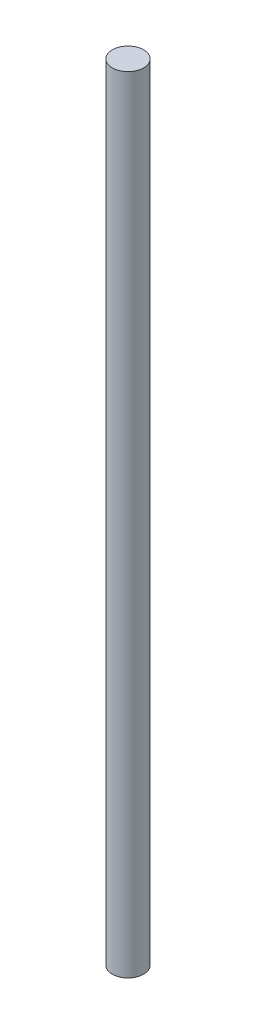
from build123d import *

# Parameters (mm, degrees)
SKETCH_1_R      = 6
EXTRUDE_1_DEPTH = 300


with BuildPart() as part:
    # 草图1 → 凸台-拉伸1 (new body)
    with BuildSketch(Plane(origin=(0, 0, 0), x_dir=(1, 0, 0), z_dir=(0, 1, 0))):
        Circle(SKETCH_1_R)
    extrude(amount=EXTRUDE_1_DEPTH)


solid = part.part
